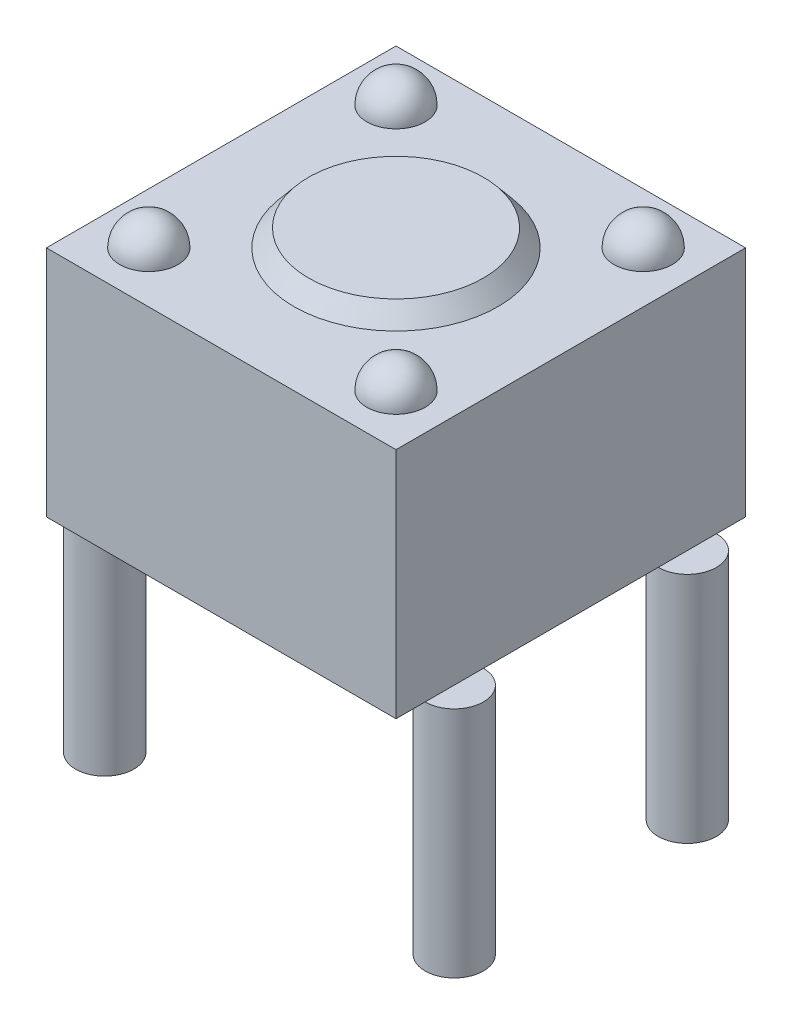
from build123d import *

# Parameters (mm, degrees)
SKETCH1_W           = 6
SKETCH1_H           = 6
BOSS_EXTRUDE1_DEPTH = 4
BOSS_EXTRUDE2_START = -4
SKETCH2_R           = 1.75
BOSS_EXTRUDE2_DEPTH = 4.3
SKETCH4_R           = 0.5
BOSS_EXTRUDE3_DEPTH = 0.5
FILLET1_R           = 0.5
SKETCH5_R           = 0.5
BOSS_EXTRUDE4_DEPTH = 4


with BuildPart() as part:
    # Sketch1 → Boss-Extrude1 (new body)
    with BuildSketch(Plane(origin=(0, 0, 0), x_dir=(1, 0, 0), z_dir=(0, 1, 0))):
        Rectangle(SKETCH1_W, SKETCH1_H)
    extrude(amount=BOSS_EXTRUDE1_DEPTH)

    # Sketch2 → Boss-Extrude2 (add)
    with BuildSketch(Plane(origin=(0, 4, 0), x_dir=(1, 0, 0), z_dir=(0, 1, 0)).offset(BOSS_EXTRUDE2_START)):
        with Locations(Location((0, 0, 0), (0, 0, 90))):
            Circle(SKETCH2_R)
    extrude(amount=BOSS_EXTRUDE2_DEPTH)

    # Sketch3 → Cut-Revolve1 (revolve, cut)
    with BuildSketch(Plane(origin=(0, 0, 0), x_dir=(0, 0, -1), z_dir=(1, 0, 0))):
        Polygon((-1.75, 4.3), (-1.75, 4), (-1.5, 4.3), align=None)
    revolve(axis=Axis((0, 8.374446569, 0), (0, -1, 0)), mode=Mode.SUBTRACT)

    # Sketch4 → Boss-Extrude3 (add)
    with BuildSketch(Plane(origin=(0, 4, 0), x_dir=(1, 0, 0), z_dir=(0, 1, 0))):
        with Locations(Location((-2.121320344, 2.121320344, 0), (0, 0, 270))):
            Circle(SKETCH4_R)
        with Locations(Location((2.121320344, 2.121320344, 0), (0, 0, 270))):
            Circle(SKETCH4_R)
        with Locations(Location((2.121320344, -2.121320344, 0), (0, 0, 270))):
            Circle(SKETCH4_R)
        with Locations(Location((-2.121320344, -2.121320344, 0), (0, 0, 270))):
            Circle(SKETCH4_R)
    extrude(amount=BOSS_EXTRUDE3_DEPTH)

    # Fillet1
    fillet1_edges = [part.edges().sort_by_distance(p)[0] for p in [
        (-2.121320344, 4.5, -2.621320344),
        (2.121320344, 4.5, -2.621320344),
        (2.121320344, 4.5, 1.621320344),
        (-2.121320344, 4.5, 1.621320344),
    ]]
    fillet(fillet1_edges, radius=FILLET1_R - 0.0001)  # a hair under: the kernel refuses the full size

    # Sketch5 → Boss-Extrude4 (add)
    with BuildSketch(Plane(origin=(0, 0, 0), x_dir=(1, 0, 0), z_dir=(0, 1, 0))):
        with Locations(Location((3, -2, 0), (0, 0, 270))):
            Circle(SKETCH5_R)
        with Locations(Location((3, 2, 0), (0, 0, 90))):
            Circle(SKETCH5_R)
        with Locations(Location((-3, 2, 0), (0, 0, 270))):
            Circle(SKETCH5_R)
        with Locations(Location((-3, -2, 0), (0, 0, 90))):
            Circle(SKETCH5_R)
    extrude(amount=-BOSS_EXTRUDE4_DEPTH)


solid = part.part
